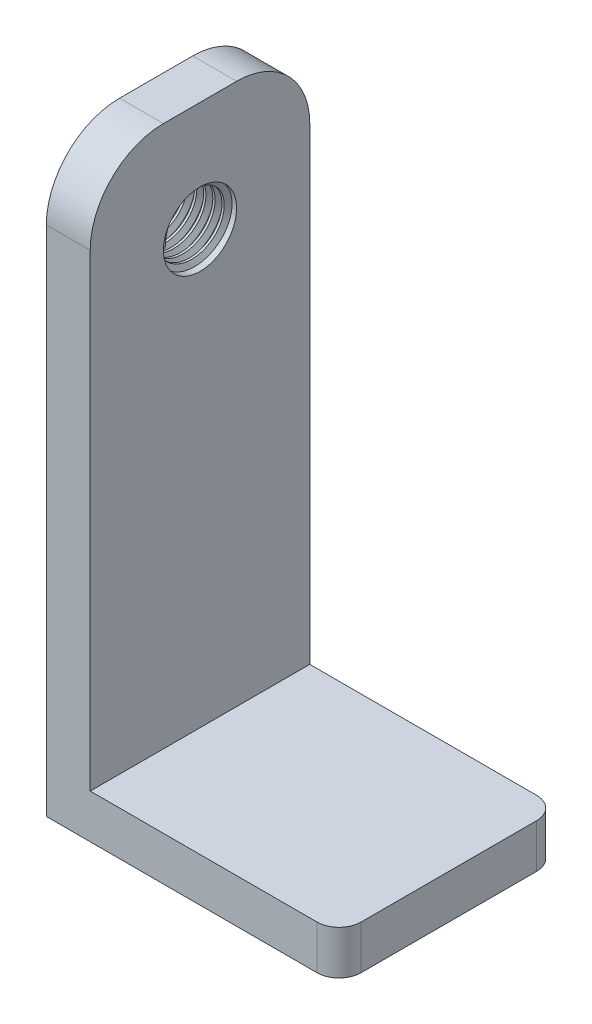
from build123d import *

# Parameters (mm, degrees)
BOSS_EXTRUDE1_DEPTH = 15
SKETCH2_R           = 5
CUT_EXTRUDE1_DEPTH  = 30
FILLET1_R           = 10
FILLET2_R           = 3
THREAD1_PITCH       = 1.25


with BuildPart() as part:
    # Sketch1 → Boss-Extrude1 (new, symmetric)
    with BuildSketch(Plane.XY):
        Polygon((0, 80), (0, 0), (40, 0), (40, 6), (6, 6), (6, 80), align=None)
    extrude(amount=BOSS_EXTRUDE1_DEPTH, both=True)

    # Sketch2 → Cut-Extrude1 (cut)
    with BuildSketch(Plane.ZY):
        with Locations(Location((0, 65, 0), (0, 0, 270))):
            Circle(SKETCH2_R)
    extrude(amount=-CUT_EXTRUDE1_DEPTH, mode=Mode.SUBTRACT)

    # Fillet1
    fillet1_edges = [part.edges().sort_by_distance(p)[0] for p in [
        (3, 80, 15),
        (3, 80, -15),
    ]]
    fillet(fillet1_edges, radius=FILLET1_R)

    # Fillet2
    fillet2_edges = [part.edges().sort_by_distance(p)[0] for p in [
        (40, 3, 15),
        (40, 3, -15),
    ]]
    fillet(fillet2_edges, radius=FILLET2_R)

    # Thread1: the profile of Thread Profile1 profile screwed along a right-hand helix of 7.2 turns, 8 arcs to a turn; built about Z, then put on its axis
    thread1_z = Axis((0, 0, 0), (0, 0, 1))
    thread1_corners = [(5.0003, 0, -0.000173), (5.0003, 0, 1.093923), (4.323418, 0, 0.703125), (4.323418, 0, 0.390625)]
    with BuildLine(mode=Mode.PRIVATE) as thread1_profile:
        Line(thread1_corners[0], thread1_corners[1])
        Line(thread1_corners[1], thread1_corners[2])
        Line(thread1_corners[2], thread1_corners[3])
        Line(thread1_corners[3], thread1_corners[0])
    thread1_cap = Face(thread1_profile.wire())
    thread1_turn_angles = [0, 22.5, 45, 67.5, 90, 112.5, 135, 157.5, 180, 202.5, 225, 247.5, 270, 292.5, 315, 337.5, 360]
    thread1_turn_weights = [1, 0.9238795325112867, 1, 0.9238795325112867, 1, 0.9238795325112867, 1, 0.9238795325112867, 1, 0.9238795325112867, 1, 0.9238795325112867, 1, 0.9238795325112867, 1, 0.9238795325112867, 1]
    thread1_turn_rails = [Edge.make_bspline([Vector(p[0], p[1], 0).rotate(thread1_z, thread1_turn_angles[k]) / thread1_turn_weights[k] + Vector(0, 0, p[2] + THREAD1_PITCH * thread1_turn_angles[k] / 360) for k in range(17)], [0, 0, 0, 1, 1, 2, 2, 3, 3, 4, 4, 5, 5, 6, 6, 7, 7, 8, 8, 8], 2, thread1_turn_weights) for p in thread1_corners]
    thread1_turn_sides = [Face.make_surface_from_curves(thread1_turn_rails[p[0]], thread1_turn_rails[p[1]]) for p in [(0, 1), (1, 2), (2, 3), (3, 0)]]
    thread1_last_angles = [2520, 2542.5, 2565, 2578.5, 2592]
    thread1_last_weights = [1, 0.9238795325112867, 1, 0.9723699203976766, 1]
    thread1_last_rails = [Edge.make_bspline([Vector(p[0], p[1], 0).rotate(thread1_z, thread1_last_angles[k]) / thread1_last_weights[k] + Vector(0, 0, p[2] + THREAD1_PITCH * thread1_last_angles[k] / 360) for k in range(5)], [0, 0, 0, 1, 1, 2, 2, 2], 2, thread1_last_weights) for p in thread1_corners]
    thread1_last_sides = [Face.make_surface_from_curves(thread1_last_rails[p[0]], thread1_last_rails[p[1]]) for p in [(0, 1), (1, 2), (2, 3), (3, 0)]]
    thread1 = Plane(origin=(6, 65, 0), x_dir=(0, 0, 1), z_dir=(-1, 0, 0)) * Solid(Shell([*[p.moved(Location((0, 0, THREAD1_PITCH * i))) for i in range(7) for p in thread1_turn_sides], *thread1_last_sides, thread1_cap, thread1_cap.rotate(thread1_z, 2592).moved(Location((0, 0, THREAD1_PITCH * 2592 / 360)))]))
    add(thread1)


solid = part.part
